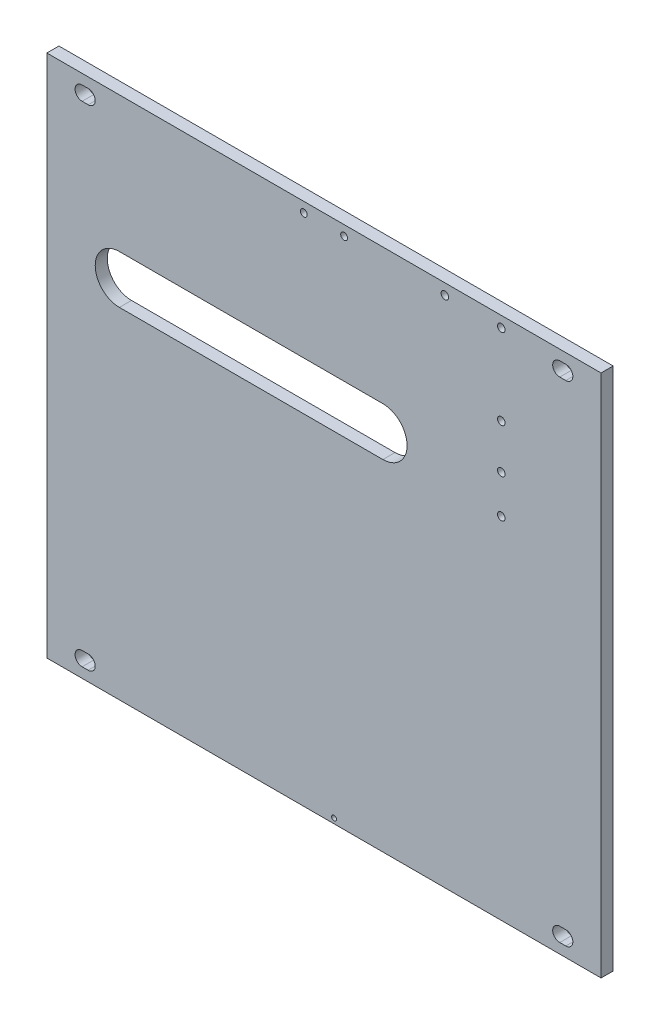
from build123d import *

# Parameters (mm, degrees)
CROQUIS1_W                      = 275
CROQUIS1_H                      = 260
BRIDA_BASE1_DEPTH               = 6
CORTAR_EXTRUIR1_DEPTH           = 190.320495457
CORTAR_EXTRUIR1_DEPTH_BACK      = 190.320495457
CROQUIS3_R                      = 1.875
CORTAR_EXTRUIR2_DEPTH           = 190.320495457
CORTAR_EXTRUIR2_DEPTH_BACK      = 190.320495457
RANURA_START                    = -6
RANURA_DE_MARGEN_PARA_M61_DEPTH = 6
CROQUIS9_R                      = 1.2
CORTAR_EXTRUIR4_DEPTH           = 190.320495457
TALADRO_DE_MARGEN_PARA_M31_D    = 3.4


# Read off the part's stored shape, not the designer's step: Ranura de margen para M61
# Sheet-metal steps are written as plain solids
with BuildPart() as part:
    # Croquis1 → Brida base1 (new body)
    with BuildSketch(Plane.XY):
        Rectangle(CROQUIS1_W, CROQUIS1_H)
    extrude(amount=-BRIDA_BASE1_DEPTH)

    # Croquis3 → Cortar-Extruir1 (cut, two sides: drawn at the far end of the back side and taken through both)
    with BuildSketch(Plane(origin=(0, 0, -6), x_dir=(-1, 0, 0), z_dir=(0, 0, -1)).offset(-CORTAR_EXTRUIR1_DEPTH_BACK)):
        with Locations((-88, 84.63)):
            Circle(CROQUIS3_R)
        with Locations((-60, 124.63)):
            Circle(CROQUIS3_R)
        with Locations((-88, 124.63)):
            Circle(CROQUIS3_R)
        with Locations((-88, 62.63)):
            Circle(CROQUIS3_R)
        with Locations((-88, 43.63)):
            Circle(CROQUIS3_R)
    extrude(amount=CORTAR_EXTRUIR1_DEPTH + CORTAR_EXTRUIR1_DEPTH_BACK, mode=Mode.SUBTRACT)

    # Croquis4 → Cortar-Extruir2 (cut, two sides: drawn at the far end of the back side and taken through both)
    with BuildSketch(Plane.XY.offset(-CORTAR_EXTRUIR2_DEPTH_BACK)):
        with BuildLine():
            Line((-101.5, 38.67), (29.25, 38.67))
            ThreePointArc((29.25, 38.67), (41.25, 50.67), (29.25, 62.67))
            Line((29.25, 62.67), (-101.5, 62.67))
            ThreePointArc((-101.5, 62.67), (-113.5, 50.67), (-101.5, 38.67))
        make_face()
    extrude(amount=CORTAR_EXTRUIR2_DEPTH + CORTAR_EXTRUIR2_DEPTH_BACK, mode=Mode.SUBTRACT)

    # Ranura de margen para M61 outline → Ranura de margen para M61 (cut)
    with BuildSketch(Plane.XY.offset(RANURA_START)):
        with BuildLine():
            Line((117, 118), (120, 118))
            ThreePointArc((120, 118), (123.5, 121.5), (120, 125))
            Line((120, 125), (117, 125))
            ThreePointArc((117, 125), (113.5, 121.5), (117, 118))
        make_face()
        with BuildLine():
            ThreePointArc((-117, 118), (-113.5, 121.5), (-117, 125))
            Line((-117, 125), (-120, 125))
            ThreePointArc((-120, 125), (-123.5, 121.5), (-120, 118))
            Line((-120, 118), (-117, 118))
        make_face()
        with BuildLine():
            Line((-120, -125), (-117, -125))
            ThreePointArc((-117, -125), (-113.5, -121.5), (-117, -118))
            Line((-117, -118), (-120, -118))
            ThreePointArc((-120, -118), (-123.5, -121.5), (-120, -125))
        make_face()
        with BuildLine():
            ThreePointArc((120, -125), (123.5, -121.5), (120, -118))
            Line((120, -118), (117, -118))
            ThreePointArc((117, -118), (113.5, -121.5), (117, -125))
            Line((117, -125), (120, -125))
        make_face()
    extrude(amount=RANURA_DE_MARGEN_PARA_M61_DEPTH, mode=Mode.SUBTRACT)

    # Croquis9 → Cortar-Extruir4 (cut, through all)
    with BuildSketch(Plane.XY):
        with Locations((5, -127.5)):
            Circle(CROQUIS9_R)
    extrude(amount=-CORTAR_EXTRUIR4_DEPTH, mode=Mode.SUBTRACT)

    # Taladro de margen para M31 (through all)
    with Locations(Plane.XY):
        with Locations((10, 125), (-10, 125)):
            Hole(TALADRO_DE_MARGEN_PARA_M31_D / 2)


solid = part.part
